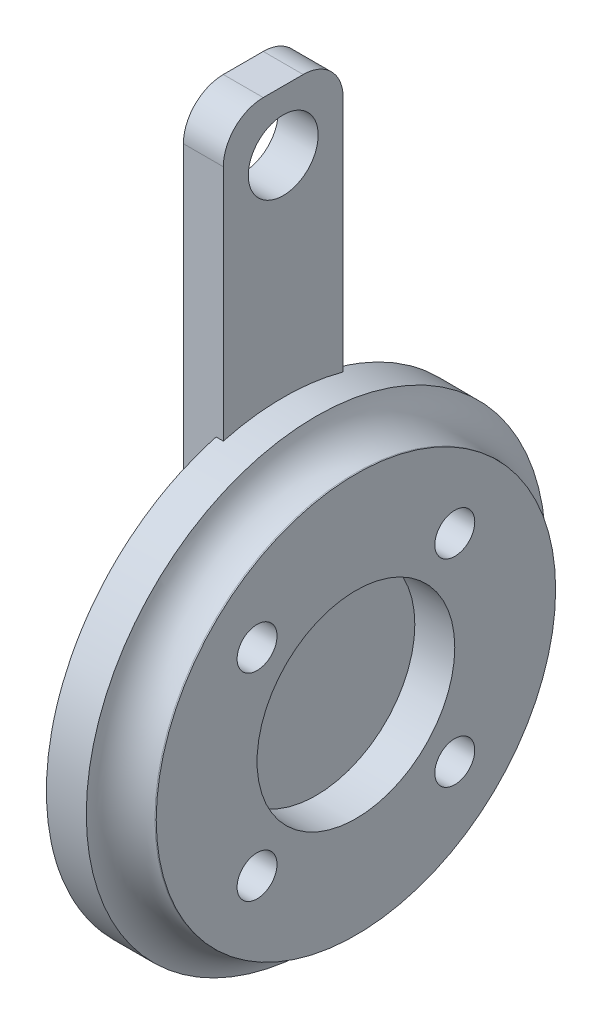
from build123d import *

# Parameters (mm, degrees)
SKETCH1_R           = 11.5
SKETCH1_R_2         = 10.5
BOSS_EXTRUDE1_DEPTH = 2
SKETCH1_2_R         = 10.5
BOSS_EXTRUDE2_DEPTH = 2
SKETCH3_R           = 9.5
CUT_EXTRUDE2_DEPTH  = 1.5
SKETCH6_W           = 30
SKETCH6_H           = 6
SKETCH6_R           = 1.75
BOSS_EXTRUDE3_DEPTH = 2
SKETCH7_R           = 10
SKETCH7_R_2         = 1
SKETCH7_R_3         = 4.95
BOSS_EXTRUDE4_DEPTH = 2
FILLET1_R           = 2
FILLET2_R           = 2


with BuildPart() as part:
    # Sketch1 → Boss-Extrude1 (new body)
    with BuildSketch(Plane.YZ):
        with Locations(Location((0, 0, 0), (0, 0, 270))):
            Circle(SKETCH1_R)
        with Locations(Location((0, 0, 0), (0, 0, 270))):
            Circle(SKETCH1_R_2, mode=Mode.SUBTRACT)
    extrude(amount=BOSS_EXTRUDE1_DEPTH)

    # Sketch1<2> → Boss-Extrude2 (add)
    with BuildSketch(Plane.YZ):
        Circle(SKETCH1_2_R)
    extrude(amount=BOSS_EXTRUDE2_DEPTH)

    # Sketch3 → Cut-Extrude2 (cut)
    with BuildSketch(Plane(origin=(0, 0, 0), x_dir=(0, -1, 0), z_dir=(-1, 0, 0))):
        with Locations(Location((0, 0, 0), (0, 0, 90))):
            Circle(SKETCH3_R)
    extrude(amount=-CUT_EXTRUDE2_DEPTH, mode=Mode.SUBTRACT)

    # Sketch4 for Loft1 → Loft1 section 0
    with BuildSketch(Plane(origin=(0, 0, 0), x_dir=(0, -1, 0), z_dir=(-1, 0, 0))):
        with BuildLine():
            # circular arc as an exact rational Bezier (weights 1, cos(half-angle), 1)
            Bezier((9.861168646, -5.916701187), (13.411189358, 0), (9.861168646, 5.916701187), weights=[1, 0.857492926, 1])
            Bezier((9.861168646, 5.916701187), (0, 22.351982265), (-9.861168646, 5.916701187), weights=[1, 0.514495755, 1])
            Bezier((-9.861168646, 5.916701187), (-13.411189358, 0), (-9.861168646, -5.916701187), weights=[1, 0.857492926, 1])
            Bezier((-9.861168646, -5.916701187), (0, -22.351982265), (9.861168646, -5.916701187), weights=[1, 0.514495755, 1])
        make_face()
    # Sketch2 → Loft1 section 1
    with BuildSketch(Plane.ZY.offset(1.64)):
        with BuildLine():
            Line((-3, -5), (3, -5))
            Line((3, -5), (3, 5))
            Line((3, 5), (-3, 5))
            Line((-3, 5), (-3, -5))
        make_face()
    loft()

    # Sketch6 → Boss-Extrude3 (add)
    with BuildSketch(Plane(origin=(-1.64, 0, 0), x_dir=(0, -1, 0), z_dir=(-1, 0, 0))):
        with Locations((-10, 0)):
            Rectangle(SKETCH6_W, SKETCH6_H)
        with Locations(Location((-22, 0, 0), (0, 0, 90))):
            Circle(SKETCH6_R, mode=Mode.SUBTRACT)
    extrude(amount=-BOSS_EXTRUDE3_DEPTH)

    # Sketch7 → Boss-Extrude4 (add)
    with BuildSketch(Plane.YZ.offset(2)):
        with Locations(Location((0, 0, 0), (0, 0, 270))):
            Circle(SKETCH7_R)
        with Locations(Location((-4.95, 4.95, 0), (0, 0, 270))):
            Circle(SKETCH7_R_2, mode=Mode.SUBTRACT)
        with Locations(Location((4.95, 4.95, 0), (0, 0, 270))):
            Circle(SKETCH7_R_2, mode=Mode.SUBTRACT)
        with Locations(Location((4.95, -4.95, 0), (0, 0, 270))):
            Circle(SKETCH7_R_2, mode=Mode.SUBTRACT)
        with Locations(Location((-4.95, -4.95, 0), (0, 0, 270))):
            Circle(SKETCH7_R_2, mode=Mode.SUBTRACT)
        with Locations(Location((0, 0, 0), (0, 0, 270))):
            Circle(SKETCH7_R_3, mode=Mode.SUBTRACT)
    extrude(amount=BOSS_EXTRUDE4_DEPTH)

    # Fillet1
    # the kernel refuses this fillet: 2 mm, written as the material it adds along each edge
    with BuildSketch(Plane(origin=(2, 0, 0), x_dir=(0, 0, -1), z_dir=(0, -1, 0))) as fillet1_piece_1:
        with BuildLine():
            CenterArc((12, 1.936491673), FILLET1_R, 180, 75.522487814)
            Line((10, 1.936491673), (9.96, 1.936491673))
            Line((9.96, 1.936491673), (9.96, 0))
            Line((9.96, 0), (10, -0.04))
            ThreePointArc((10, -0.04), (10.75, -0.04), (11.49, -0.038729833))
            Line((11.49, -0.038729833), (11.5, 0))
        make_face()
    revolve(axis=Axis((2, 0, 0), (1, 0, 0)))

    # Fillet2
    fillet2_edges = [part.edges().sort_by_distance(p)[0] for p in [
        (-0.64, 25, 3),
        (-0.64, 25, -3),
    ]]
    fillet(fillet2_edges, radius=FILLET2_R)


solid = part.part
